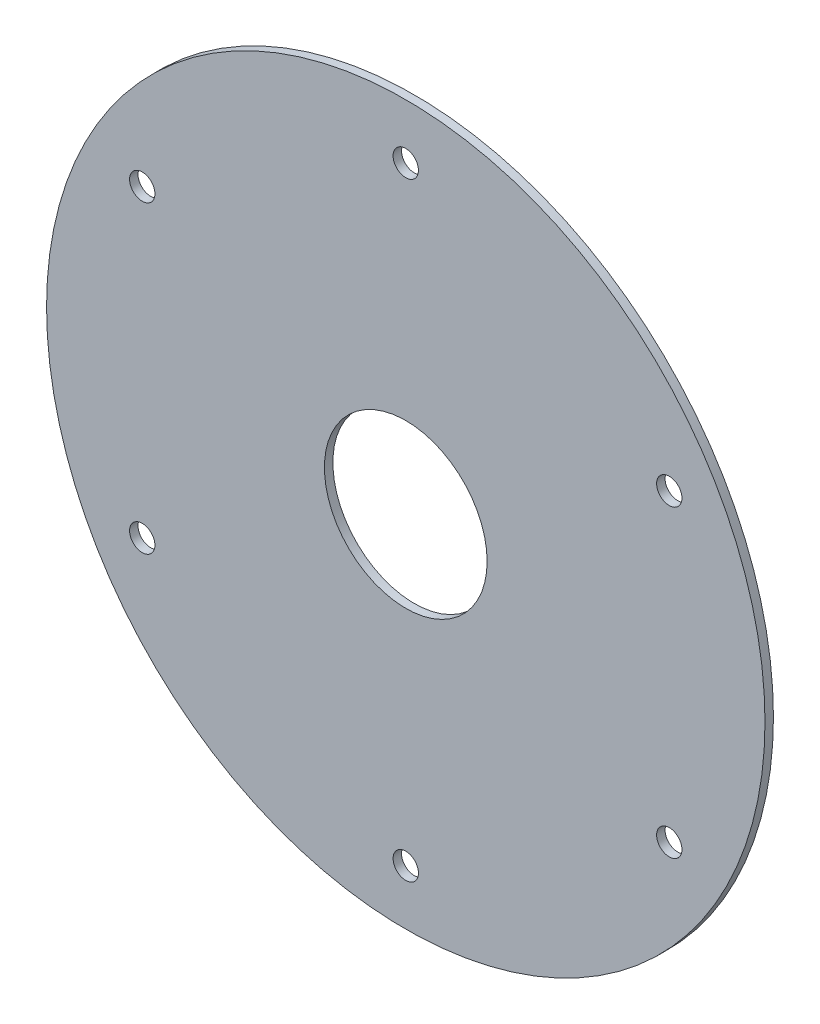
from build123d import *

# Parameters (mm, degrees)
SKETCH_1_R             = 170
SKETCH_1_R_2           = 38.5
SKETCH_1_R_3           = 6
SM_BASE_FLANGE_1_DEPTH = 4


# Sheet-metal steps are written as plain solids
with BuildPart() as part:
    # Sketch 1 → Базовая кромка1 (new body)
    with BuildSketch(Plane.XY):
        Circle(SKETCH_1_R)
        Circle(SKETCH_1_R_2, mode=Mode.SUBTRACT)
        with Locations((0, 144)):
            Circle(SKETCH_1_R_3, mode=Mode.SUBTRACT)
        with Locations((124.707658145, 72)):
            Circle(SKETCH_1_R_3, mode=Mode.SUBTRACT)
        with Locations((124.707658145, -72)):
            Circle(SKETCH_1_R_3, mode=Mode.SUBTRACT)
        with Locations((0, -144)):
            Circle(SKETCH_1_R_3, mode=Mode.SUBTRACT)
        with Locations((-124.707658145, -72)):
            Circle(SKETCH_1_R_3, mode=Mode.SUBTRACT)
        with Locations((-124.707658145, 72)):
            Circle(SKETCH_1_R_3, mode=Mode.SUBTRACT)
    extrude(amount=SM_BASE_FLANGE_1_DEPTH)


solid = part.part
